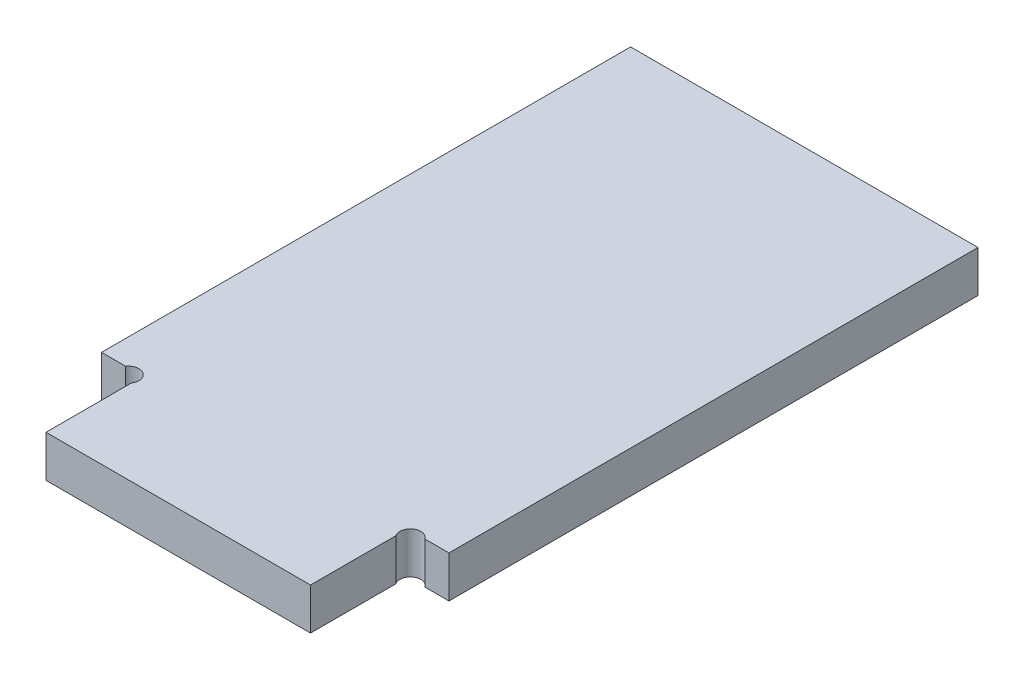
from build123d import *

# Parameters (mm, degrees)
BOSS_EXTRUDE1_DEPTH = 0.3


with BuildPart() as part:
    # Sketch1 → Boss-Extrude1 (new, symmetric)
    with BuildSketch(Plane(origin=(0, 0, 0), x_dir=(1, 0, 0), z_dir=(0, 1, 0))):
        with BuildLine():
            Line((-1.905, -0.167031015), (-1.905, -1.397))
            Line((-1.905, -1.397), (1.905, -1.397))
            Line((1.905, -1.397), (1.905, -0.167031015))
            ThreePointArc((1.905, -0.167031015), (1.946084492, 0.041084492), (2.1542, 0))
            Line((2.1542, 0), (2.5019, 0))
            Line((2.5019, 0), (2.5019, 7.62))
            Line((2.5019, 7.62), (-2.5019, 7.62))
            Line((-2.5019, 7.62), (-2.5019, 0))
            Line((-2.5019, 0), (-2.1542, 0))
            ThreePointArc((-2.1542, 0), (-1.946084492, 0.041084492), (-1.905, -0.167031015))
        make_face()
    extrude(amount=BOSS_EXTRUDE1_DEPTH, both=True)


solid = part.part
